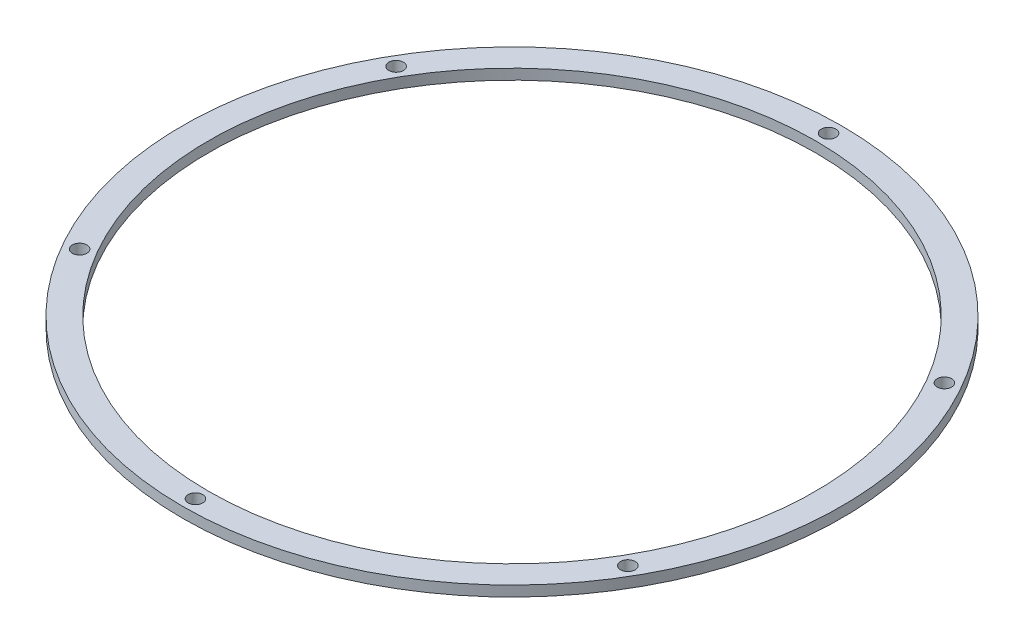
from build123d import *

# Parameters (mm, degrees)
SKETCH1_R           = 160.85
SKETCH1_R_2         = 3.556
SKETCH1_R_3         = 148.15
BOSS_EXTRUDE1_DEPTH = 5.08


with BuildPart() as part:
    # Sketch1 → Boss-Extrude1 (new body)
    with BuildSketch(Plane(origin=(0, 0, 0), x_dir=(1, 0, 0), z_dir=(0, 1, 0))):
        Circle(SKETCH1_R)
        with Locations((0, 154.5)):
            Circle(SKETCH1_R_2, mode=Mode.SUBTRACT)
        with Locations((133.800924885, 77.25)):
            Circle(SKETCH1_R_2, mode=Mode.SUBTRACT)
        with Locations((133.800924885, -77.25)):
            Circle(SKETCH1_R_2, mode=Mode.SUBTRACT)
        with Locations((0, -154.5)):
            Circle(SKETCH1_R_2, mode=Mode.SUBTRACT)
        with Locations((-133.800924885, -77.25)):
            Circle(SKETCH1_R_2, mode=Mode.SUBTRACT)
        with Locations((-133.800924885, 77.25)):
            Circle(SKETCH1_R_2, mode=Mode.SUBTRACT)
        Circle(SKETCH1_R_3, mode=Mode.SUBTRACT)
    extrude(amount=BOSS_EXTRUDE1_DEPTH)


solid = part.part
